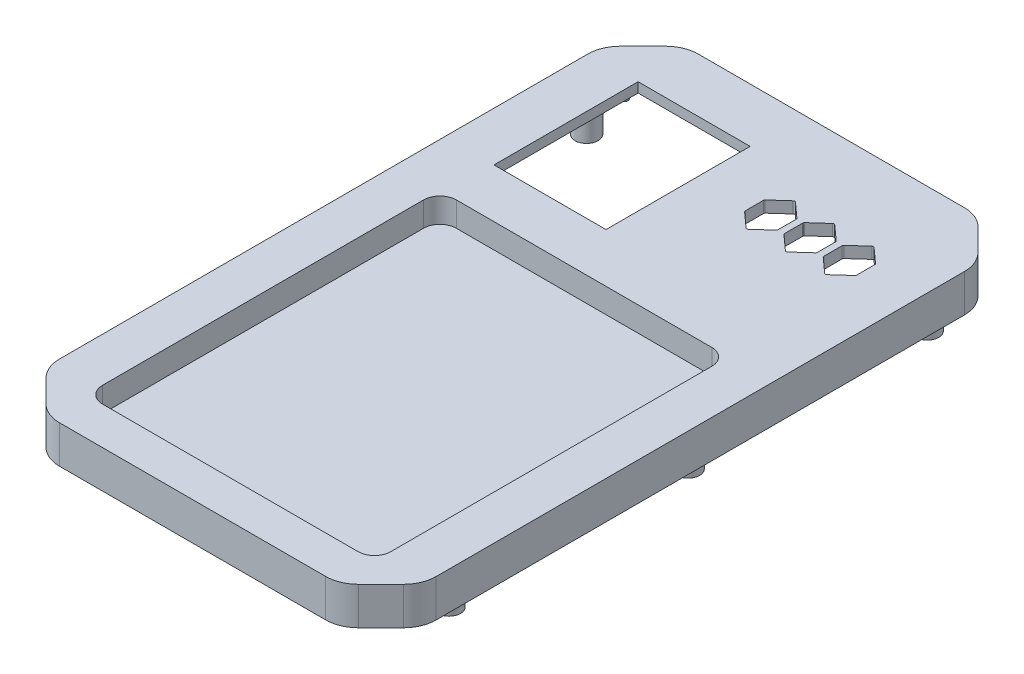
from build123d import *

# Parameters (mm, degrees)
BOSS_EXTRUDE4_DEPTH             = 20
FILLET4_R                       = 10
SKETCH5_W                       = 34.2
SKETCH5_H                       = 44
CUT_EXTRUDE4_DEPTH              = 7.5
SKETCH28_W                      = 49
SKETCH28_H                      = 35
CUT_EXTRUDE17_DEPTH             = 13
SHELL2_START                    = 1.5
SHELL2_OUTLINE_W                = 52
SHELL2_OUTLINE_H                = 38
SHELL2_DEPTH                    = 9.5
SHELL2_START_2                  = 11
SHELL2_2_OUTLINE_W              = 37.2
SHELL2_2_OUTLINE_H              = 47
SHELL2_2_OUTLINE_W_2            = 52
SHELL2_2_OUTLINE_H_2            = 38
SHELL2_2_DEPTH                  = 7.5
SHELL2_START_3                  = 14.5
SHELL2_3_OUTLINE_W              = 52
SHELL2_3_OUTLINE_H              = 38
SHELL2_3_DEPTH                  = 4
CUT_EXTRUDE15_REACH             = 218.444
FILLET3_R                       = 0.5
CUT_EXTRUDE18_REACH             = 217.88
SKETCH29_W                      = 34.2
SKETCH29_H                      = 44
BOSS_EXTRUDE11_DEPTH            = 9
SKETCH33_W                      = 1.5
SKETCH33_H                      = 4.6
CUT_EXTRUDE19_DEPTH             = 3
SKETCH34_W                      = 51
SKETCH34_H                      = 37
CUT_EXTRUDE22_DEPTH             = 3
SKETCH37_W                      = 25
SKETCH37_H                      = 11
BOSS_EXTRUDE13_DEPTH            = 7
CUT_EXTRUDE25_DEPTH             = 3
SKETCH38_R                      = 1.5
CUT_EXTRUDE26_DEPTH             = 5
SKETCH39_W                      = 7
SKETCH39_H                      = 2
CUT_EXTRUDE27_DEPTH             = 5
CUT_EXTRUDE28_START             = -10
CUT_EXTRUDE28_DEPTH             = 10
BOSS_EXTRUDE14_DEPTH            = 1.5
SKETCH46_R                      = 3.5
BOSS_EXTRUDE16_DEPTH            = 14
SKETCH52_R                      = 0.6
CUT_EXTRUDE30_DEPTH             = 12
CUT_EXTRUDE31_REACH             = 198.273
CUT_EXTRUDE31_DIRECTION_2_REACH = 198.273
SKETCH54_W                      = 37.2
SKETCH54_H                      = 47
CUT_EXTRUDE33_DEPTH             = 6
BOSS_EXTRUDE17_REACH            = 217.88
SKETCH57_W                      = 45
SKETCH57_H                      = 54
SKETCH57_W_2                    = 37.2
SKETCH57_H_2                    = 47
SKETCH58_R                      = 1.2
BOSS_EXTRUDE18_DEPTH            = 2
CUT_EXTRUDE34_DEPTH             = 0.5
BOSS_EXTRUDE19_DEPTH            = 2


# Read off the part's stored shape, not the designer's step: Shell2
with BuildPart() as part:
    # Sketch1 → Boss-Extrude4 (new body)
    with BuildSketch(Plane(origin=(0, 0, 0), x_dir=(1, 0, 0), z_dir=(0, 1, 0))):
        Polygon((12.727922061, 12.727922061), (102.272077939, 12.727922061), (115, 0), (115, -169.544155877), (102.272077939, -182.272077939), (12.727922061, -182.272077939), (0, -169.544155877), (0, 0), align=None)
    extrude(amount=BOSS_EXTRUDE4_DEPTH)

    # Fillet4
    fillet4_edges = [part.edges().sort_by_distance(p)[0] for p in [
        (115, 10, 0),
        (115, 10, 169.544155877),
        (102.272077939, 10, 182.272077939),
        (12.727922061, 10, 182.272077939),
        (0, 10, 169.544155877),
        (0, 10, 0),
        (12.727922061, 10, -12.727922061),
        (102.272077939, 10, -12.727922061),
    ]]
    fillet(fillet4_edges, radius=FILLET4_R)

    # Sketch5 → Cut-Extrude4 (cut)
    with BuildSketch(Plane(origin=(0, 20, 0), x_dir=(1, 0, 0), z_dir=(0, 1, 0))):
        with Locations((32.1, -25.772077939)):
            Rectangle(SKETCH5_W, SKETCH5_H)
        with BuildLine():
            Line((96.5, -62.772077939), (18.5, -62.772077939))
            ThreePointArc((18.5, -62.772077939), (14.964466094, -64.236544033), (13.5, -67.772077939))
            Line((13.5, -67.772077939), (13.5, -165.772077939))
            ThreePointArc((13.5, -165.772077939), (14.964466094, -169.307611845), (18.5, -170.772077939))
            Line((18.5, -170.772077939), (96.5, -170.772077939))
            ThreePointArc((96.5, -170.772077939), (100.035533906, -169.307611845), (101.5, -165.772077939))
            Line((101.5, -165.772077939), (101.5, -67.772077939))
            ThreePointArc((101.5, -67.772077939), (100.035533906, -64.236544033), (96.5, -62.772077939))
        make_face()
    extrude(amount=-CUT_EXTRUDE4_DEPTH, mode=Mode.SUBTRACT)

    # Sketch28 → Cut-Extrude17 (cut)
    with BuildSketch(Plane.XZ):
        with Locations((80.5, 39.772077939)):
            Rectangle(SKETCH28_W, SKETCH28_H)
    extrude(amount=-CUT_EXTRUDE17_DEPTH, mode=Mode.SUBTRACT)

    # Shell2 outline → Shell2 (cut)
    with BuildSketch(Plane(origin=(0, 0, 0), x_dir=(1, 0, 0), z_dir=(0, 1, 0)).offset(SHELL2_START)):
        with BuildLine():
            Line((111.01040764, 1.868272016), (104.140349955, 8.738329701))
            ThreePointArc((104.140349955, 8.738329701), (101.38275149, 10.580898088), (98.129942315, 11.227922061))
            Line((98.129942315, 11.227922061), (16.870057685, 11.227922061))
            ThreePointArc((16.870057685, 11.227922061), (13.61724851, 10.580898088), (10.859650045, 8.738329701))
            Line((10.859650045, 8.738329701), (3.98959236, 1.868272016))
            ThreePointArc((3.98959236, 1.868272016), (2.147023974, -0.889326449), (1.5, -4.142135624))
            Line((1.5, -4.142135624), (1.5, -165.402020254))
            ThreePointArc((1.5, -165.402020254), (2.147023974, -168.654829429), (3.98959236, -171.412427894))
            Line((3.98959236, -171.412427894), (10.859650045, -178.282485579))
            ThreePointArc((10.859650045, -178.282485579), (13.61724851, -180.125053965), (16.870057685, -180.772077939))
            Line((16.870057685, -180.772077939), (98.129942315, -180.772077939))
            ThreePointArc((98.129942315, -180.772077939), (101.38275149, -180.125053965), (104.140349955, -178.282485579))
            Line((104.140349955, -178.282485579), (111.01040764, -171.412427894))
            ThreePointArc((111.01040764, -171.412427894), (112.852976026, -168.654829429), (113.5, -165.402020254))
            Line((113.5, -165.402020254), (113.5, -4.142135624))
            ThreePointArc((113.5, -4.142135624), (112.852976026, -0.889326449), (111.01040764, 1.868272016))
        make_face()
        with Locations((80.5, -39.772077939)):
            Rectangle(SHELL2_OUTLINE_W, SHELL2_OUTLINE_H, mode=Mode.SUBTRACT)
    extrude(amount=SHELL2_DEPTH, mode=Mode.SUBTRACT)

    # Shell2 2 outline → Shell2 2 (cut)
    with BuildSketch(Plane(origin=(0, 0, 0), x_dir=(1, 0, 0), z_dir=(0, 1, 0)).offset(SHELL2_START_2)):
        with BuildLine():
            Line((111.01040764, 1.868272016), (104.140349955, 8.738329701))
            ThreePointArc((104.140349955, 8.738329701), (101.38275149, 10.580898088), (98.129942315, 11.227922061))
            Line((98.129942315, 11.227922061), (16.870057685, 11.227922061))
            ThreePointArc((16.870057685, 11.227922061), (13.61724851, 10.580898088), (10.859650045, 8.738329701))
            Line((10.859650045, 8.738329701), (3.98959236, 1.868272016))
            ThreePointArc((3.98959236, 1.868272016), (2.147023974, -0.889326449), (1.5, -4.142135624))
            Line((1.5, -4.142135624), (1.5, -165.402020254))
            ThreePointArc((1.5, -165.402020254), (2.147023974, -168.654829429), (3.98959236, -171.412427894))
            Line((3.98959236, -171.412427894), (10.859650045, -178.282485579))
            ThreePointArc((10.859650045, -178.282485579), (13.61724851, -180.125053965), (16.870057685, -180.772077939))
            Line((16.870057685, -180.772077939), (98.129942315, -180.772077939))
            ThreePointArc((98.129942315, -180.772077939), (101.38275149, -180.125053965), (104.140349955, -178.282485579))
            Line((104.140349955, -178.282485579), (111.01040764, -171.412427894))
            ThreePointArc((111.01040764, -171.412427894), (112.852976026, -168.654829429), (113.5, -165.402020254))
            Line((113.5, -165.402020254), (113.5, -4.142135624))
            ThreePointArc((113.5, -4.142135624), (112.852976026, -0.889326449), (111.01040764, 1.868272016))
        make_face()
        with BuildLine():
            ThreePointArc((18.5, -172.272077939), (13.903805923, -170.368272017), (12, -165.772077939))
            Line((12, -165.772077939), (12, -67.772077939))
            ThreePointArc((12, -67.772077939), (13.903805922, -63.175883861), (18.5, -61.272077939))
            Line((18.5, -61.272077939), (96.5, -61.272077939))
            ThreePointArc((96.5, -61.272077939), (101.096194078, -63.175883861), (103, -67.772077939))
            Line((103, -67.772077939), (103, -165.772077939))
            ThreePointArc((103, -165.772077939), (101.096194077, -170.368272017), (96.5, -172.272077939))
            Line((96.5, -172.272077939), (18.5, -172.272077939))
        make_face(mode=Mode.SUBTRACT)
        with Locations((32.1, -25.772077939)):
            Rectangle(SHELL2_2_OUTLINE_W, SHELL2_2_OUTLINE_H, mode=Mode.SUBTRACT)
        with Locations((80.5, -39.772077939)):
            Rectangle(SHELL2_2_OUTLINE_W_2, SHELL2_2_OUTLINE_H_2, mode=Mode.SUBTRACT)
    extrude(amount=SHELL2_2_DEPTH, mode=Mode.SUBTRACT)

    # Shell2 3 outline → Shell2 3 (cut)
    with BuildSketch(Plane(origin=(0, 0, 0), x_dir=(1, 0, 0), z_dir=(0, 1, 0)).offset(SHELL2_START_3)):
        with Locations((80.5, -39.772077939)):
            Rectangle(SHELL2_3_OUTLINE_W, SHELL2_3_OUTLINE_H)
    extrude(amount=SHELL2_3_DEPTH, mode=Mode.SUBTRACT)

    # Sketch23 → Cut-Extrude15 (cut, up to next)
    with BuildSketch(Plane(origin=(0, 20, 0), x_dir=(1, 0, 0), z_dir=(0, 1, 0)), mode=Mode.PRIVATE) as cut_extrude15_sk1:
        Polygon((99.5, -21.772077939), (99.5, -15.772077939), (94.5, -11.272077939), (89.5, -15.772077939), (89.5, -21.772077939), (94.5, -26.272077939), align=None)
    cut_extrude15_tool1 = extrude(cut_extrude15_sk1.sketch, amount=-CUT_EXTRUDE15_REACH, mode=Mode.PRIVATE) & part.part
    # Sketch23 → Cut-Extrude15 (cut, up to next)
    with BuildSketch(Plane(origin=(0, 20, 0), x_dir=(1, 0, 0), z_dir=(0, 1, 0)), mode=Mode.PRIVATE) as cut_extrude15_sk2:
        Polygon((87.5, -21.772077939), (87.5, -15.772077939), (82.5, -11.272077939), (77.5, -15.772077939), (77.5, -21.772077939), (82.5, -26.272077939), align=None)
    cut_extrude15_tool2 = extrude(cut_extrude15_sk2.sketch, amount=-CUT_EXTRUDE15_REACH, mode=Mode.PRIVATE) & part.part
    # Sketch23 → Cut-Extrude15 (cut, up to next)
    with BuildSketch(Plane(origin=(0, 20, 0), x_dir=(1, 0, 0), z_dir=(0, 1, 0)), mode=Mode.PRIVATE) as cut_extrude15_sk3:
        Polygon((75.5, -21.772077939), (75.5, -15.772077939), (70.5, -11.272077939), (65.5, -15.772077939), (65.5, -21.772077939), (70.5, -26.272077939), align=None)
    cut_extrude15_tool3 = extrude(cut_extrude15_sk3.sketch, amount=-CUT_EXTRUDE15_REACH, mode=Mode.PRIVATE) & part.part
    add(cut_extrude15_tool1.solids().sort_by_distance((94.5, 20, 18.772078))[0], mode=Mode.SUBTRACT)
    add(cut_extrude15_tool2.solids().sort_by_distance((82.5, 20, 18.772078))[0], mode=Mode.SUBTRACT)
    add(cut_extrude15_tool3.solids().sort_by_distance((70.5, 20, 18.772078))[0], mode=Mode.SUBTRACT)

    # Fillet3
    fillet3_edges = [part.edges().sort_by_distance(p)[0] for p in [
        (99.5, 19.25, 21.772077939),
        (94.5, 19.25, 26.272077939),
        (89.5, 19.25, 21.772077939),
        (89.5, 19.25, 15.772077939),
        (94.5, 19.25, 11.272077939),
        (99.5, 19.25, 15.772077939),
        (87.5, 19.25, 21.772077939),
        (82.5, 19.25, 26.272077939),
        (77.5, 19.25, 21.772077939),
        (77.5, 19.25, 15.772077939),
        (82.5, 19.25, 11.272077939),
        (87.5, 19.25, 15.772077939),
        (75.5, 19.25, 21.772077939),
        (70.5, 19.25, 26.272077939),
        (65.5, 19.25, 21.772077939),
        (65.5, 19.25, 15.772077939),
        (70.5, 19.25, 11.272077939),
        (75.5, 19.25, 15.772077939),
    ]]
    fillet(fillet3_edges, radius=FILLET3_R)

    # Sketch29 → Cut-Extrude18 (cut, up to next)
    with BuildSketch(Plane(origin=(0, 12.5, 0), x_dir=(1, 0, 0), z_dir=(0, 1, 0)), mode=Mode.PRIVATE) as cut_extrude18_sk1:
        with Locations((32.1, -25.772077939)):
            Rectangle(SKETCH29_W, SKETCH29_H)
    cut_extrude18_tool1 = extrude(cut_extrude18_sk1.sketch, amount=-CUT_EXTRUDE18_REACH, mode=Mode.PRIVATE) & part.part
    add(cut_extrude18_tool1.solids().sort_by_distance((32.1, 12.5, 25.772078))[0], mode=Mode.SUBTRACT)

    # Sketch30 → Boss-Extrude11 (add)
    with BuildSketch(Plane.XZ.offset(-13)):
        Polygon((58, 32.972077939), (58, 30.672077939), (57, 30.672077939), (57, 37.172077939), (58, 37.172077939), (58, 34.422077939), (103, 34.422077939), (103, 37.172077939), (104, 37.172077939), (104, 30.672077939), (103, 30.672077939), (103, 32.972077939), align=None)
        Polygon((58, 45.122077939), (103, 45.122077939), (103, 42.822077939), (104, 42.822077939), (104, 49.322077939), (103, 49.322077939), (103, 46.572077939), (58, 46.572077939), (58, 49.322077939), (57, 49.322077939), (57, 42.822077939), (58, 42.822077939), align=None)
    extrude(amount=BOSS_EXTRUDE11_DEPTH)

    # Sketch33 → Cut-Extrude19 (cut)
    with BuildSketch(Plane(origin=(0, 14.5, 0), x_dir=(1, 0, 0), z_dir=(0, 1, 0))):
        with Locations((55.25, -52.472077939)):
            Rectangle(SKETCH33_W, SKETCH33_H)
        with Locations((105.75, -27.072077939)):
            Rectangle(SKETCH33_W, SKETCH33_H)
    extrude(amount=-CUT_EXTRUDE19_DEPTH, mode=Mode.SUBTRACT)

    # Sketch34 → Cut-Extrude22 (cut)
    with BuildSketch(Plane.XZ):
        with Locations((80.5, 39.772077939)):
            Rectangle(SKETCH34_W, SKETCH34_H)
    extrude(amount=-CUT_EXTRUDE22_DEPTH, mode=Mode.SUBTRACT)

    # Sketch37 → Boss-Extrude13 (add)
    with BuildSketch(Plane(origin=(0, 1.5, 0), x_dir=(1, 0, 0), z_dir=(0, 1, 0))):
        with Locations((80.5, -15.272077939)):
            Rectangle(SKETCH37_W, SKETCH37_H)
    extrude(amount=BOSS_EXTRUDE13_DEPTH)

    # Sketch35 → Cut-Extrude25 (cut)
    with BuildSketch(Plane.XZ):
        with BuildLine():
            Line((88.5, 21.272077939), (72.5, 21.272077939))
            ThreePointArc((72.5, 21.272077939), (80.5, 13.272077939), (88.5, 21.272077939))
        make_face()
    extrude(amount=-CUT_EXTRUDE25_DEPTH, mode=Mode.SUBTRACT)

    # Sketch38 → Cut-Extrude26 (cut)
    with BuildSketch(Plane.XZ.offset(-3)):
        with Locations(Location((80.5, 18.272077939, 0), (0, 0, 270))):
            Circle(SKETCH38_R)
    extrude(amount=-CUT_EXTRUDE26_DEPTH, mode=Mode.SUBTRACT)

    # Sketch39 → Cut-Extrude27 (cut)
    with BuildSketch(Plane(origin=(0, 0, 58.272077939), x_dir=(-1, 0, 0), z_dir=(0, 0, -1))):
        with Locations((-94.5, 2)):
            Rectangle(SKETCH39_W, SKETCH39_H)
        with Locations((-66.5, 2)):
            Rectangle(SKETCH39_W, SKETCH39_H)
    extrude(amount=-CUT_EXTRUDE27_DEPTH, mode=Mode.SUBTRACT)

    # Sketch40 → Cut-Extrude28 (cut)
    with BuildSketch(Plane.XZ.offset(CUT_EXTRUDE28_START)):
        with BuildLine():
            Line((105.201010127, -9.798989873), (112.071067812, -2.928932188))
            ThreePointArc((112.071067812, -2.928932188), (114.238795325, 0.3153013), (115, 4.142135624))
            Line((115, 4.142135624), (115, 165.402020254))
            ThreePointArc((115, 165.402020254), (114.238795325, 169.228854577), (112.071067812, 172.473088065))
            Line((112.071067812, 172.473088065), (105.201010127, 179.343145751))
            ThreePointArc((105.201010127, 179.343145751), (101.956776639, 181.510873264), (98.129942315, 182.272077939))
            Line((98.129942315, 182.272077939), (16.870057685, 182.272077939))
            ThreePointArc((16.870057685, 182.272077939), (13.043223361, 181.510873264), (9.798989873, 179.343145751))
            Line((9.798989873, 179.343145751), (2.928932188, 172.473088065))
            ThreePointArc((2.928932188, 172.473088065), (0.761204675, 169.228854577), (0, 165.402020254))
            Line((0, 165.402020254), (0, 4.142135624))
            ThreePointArc((0, 4.142135624), (0.761204675, 0.3153013), (2.928932188, -2.928932188))
            Line((2.928932188, -2.928932188), (9.798989873, -9.798989873))
            ThreePointArc((9.798989873, -9.798989873), (13.043223361, -11.966717386), (16.870057685, -12.727922061))
            Line((16.870057685, -12.727922061), (98.129942315, -12.727922061))
            ThreePointArc((98.129942315, -12.727922061), (101.956776639, -11.966717386), (105.201010127, -9.798989873))
        make_face()
        with BuildLine():
            Line((98.129942315, 177.272077939), (16.870057685, 177.272077939))
            ThreePointArc((16.870057685, 177.272077939), (14.956640523, 176.891475601), (13.334523779, 175.807611845))
            Line((13.334523779, 175.807611845), (6.464466094, 168.937554159))
            ThreePointArc((6.464466094, 168.937554159), (5.380602337, 167.315437415), (5, 165.402020254))
            Line((5, 165.402020254), (5, 4.142135624))
            ThreePointArc((5, 4.142135624), (5.380602337, 2.228718462), (6.464466094, 0.606601718))
            Line((6.464466094, 0.606601718), (13.334523779, -6.263455967))
            ThreePointArc((13.334523779, -6.263455967), (14.956640523, -7.347319724), (16.870057685, -7.727922061))
            Line((16.870057685, -7.727922061), (98.129942315, -7.727922061))
            ThreePointArc((98.129942315, -7.727922061), (100.043359477, -7.347319724), (101.665476221, -6.263455967))
            Line((101.665476221, -6.263455967), (108.535533906, 0.606601718))
            ThreePointArc((108.535533906, 0.606601718), (109.619397663, 2.228718462), (110, 4.142135624))
            Line((110, 4.142135624), (110, 165.402020254))
            ThreePointArc((110, 165.402020254), (109.619397663, 167.315437415), (108.535533906, 168.937554159))
            Line((108.535533906, 168.937554159), (101.665476221, 175.807611845))
            ThreePointArc((101.665476221, 175.807611845), (100.043359477, 176.891475601), (98.129942315, 177.272077939))
        make_face(mode=Mode.SUBTRACT)
    extrude(amount=CUT_EXTRUDE28_DEPTH, mode=Mode.SUBTRACT)


with BuildPart() as cut_extrude28_piece_1:
    # of the separate pieces the step leaves, piece 1, a body of its own (cut_extrude28_pieces)
    add(part.part.solids().sort_by_distance((94.834482366, 20, 25.971043809))[0])

    # Sketch42 → Boss-Extrude14 (add)
    with BuildSketch(Plane.XZ.offset(-10)):
        with BuildLine():
            Line((16.870057685, -12.727922061), (98.129942315, -12.727922061))
            ThreePointArc((98.129942315, -12.727922061), (101.956776639, -11.966717386), (105.201010127, -9.798989873))
            Line((105.201010127, -9.798989873), (112.071067812, -2.928932188))
            ThreePointArc((112.071067812, -2.928932188), (114.238795325, 0.3153013), (115, 4.142135624))
            Line((115, 4.142135624), (115, 165.402020254))
            ThreePointArc((115, 165.402020254), (114.238795325, 169.228854577), (112.071067812, 172.473088065))
            Line((112.071067812, 172.473088065), (105.201010127, 179.343145751))
            ThreePointArc((105.201010127, 179.343145751), (101.956776639, 181.510873264), (98.129942315, 182.272077939))
            Line((98.129942315, 182.272077939), (16.870057685, 182.272077939))
            ThreePointArc((16.870057685, 182.272077939), (13.043223361, 181.510873264), (9.798989873, 179.343145751))
            Line((9.798989873, 179.343145751), (2.928932188, 172.473088065))
            ThreePointArc((2.928932188, 172.473088065), (0.761204675, 169.228854577), (0, 165.402020254))
            Line((0, 165.402020254), (0, 4.142135624))
            ThreePointArc((0, 4.142135624), (0.761204675, 0.3153013), (2.928932188, -2.928932188))
            Line((2.928932188, -2.928932188), (9.798989873, -9.798989873))
            ThreePointArc((9.798989873, -9.798989873), (13.043223361, -11.966717386), (16.870057685, -12.727922061))
        make_face()
        with BuildLine():
            Line((10.223253942, 178.918881682), (3.353196257, 172.048823997))
            ThreePointArc((3.353196257, 172.048823997), (1.315532394, 168.999244518), (0.6, 165.402020254))
            Line((0.6, 165.402020254), (0.6, 4.142135624))
            ThreePointArc((0.6, 4.142135624), (1.315532394, 0.544911359), (3.353196257, -2.504668119))
            Line((3.353196257, -2.504668119), (10.223253942, -9.374725805))
            ThreePointArc((10.223253942, -9.374725805), (13.272833421, -11.412389667), (16.870057685, -12.127922061))
            Line((16.870057685, -12.127922061), (98.129942315, -12.127922061))
            ThreePointArc((98.129942315, -12.127922061), (101.727166579, -11.412389667), (104.776746058, -9.374725805))
            Line((104.776746058, -9.374725805), (111.646803743, -2.504668119))
            ThreePointArc((111.646803743, -2.504668119), (113.684467606, 0.544911359), (114.4, 4.142135624))
            Line((114.4, 4.142135624), (114.4, 165.402020254))
            ThreePointArc((114.4, 165.402020254), (113.684467606, 168.999244518), (111.646803743, 172.048823997))
            Line((111.646803743, 172.048823997), (104.776746058, 178.918881682))
            ThreePointArc((104.776746058, 178.918881682), (101.727166579, 180.956545544), (98.129942315, 181.672077939))
            Line((98.129942315, 181.672077939), (16.870057685, 181.672077939))
            ThreePointArc((16.870057685, 181.672077939), (13.272833421, 180.956545544), (10.223253942, 178.918881682))
        make_face(mode=Mode.SUBTRACT)
    extrude(amount=BOSS_EXTRUDE14_DEPTH)

    # Sketch46 → Boss-Extrude16 (add)
    with BuildSketch(Plane.XZ.offset(-18.5)):
        with Locations(Location((5.5, 83, 0), (0, 0, 270))):
            Circle(SKETCH46_R)
        with Locations(Location((5.5, 10, 0), (0, 0, 270))):
            Circle(SKETCH46_R)
        with Locations(Location((109.5, 10, 0), (0, 0, 270))):
            Circle(SKETCH46_R)
        with Locations(Location((109.5, 83, 0), (0, 0, 270))):
            Circle(SKETCH46_R)
        with Locations(Location((109.5, 156, 0), (0, 0, 270))):
            Circle(SKETCH46_R)
        with Locations(Location((5.5, 156, 0), (0, 0, 270))):
            Circle(SKETCH46_R)
    extrude(amount=BOSS_EXTRUDE16_DEPTH)

    # Sketch52 → Cut-Extrude30 (cut)
    with BuildSketch(Plane.XZ.offset(-4.5)):
        with Locations(Location((5.5, 10, 0), (0, 0, 270))):
            Circle(SKETCH52_R)
        with Locations(Location((109.5, 10, 0), (0, 0, 270))):
            Circle(SKETCH52_R)
        with Locations(Location((5.5, 156, 0), (0, 0, 270))):
            Circle(SKETCH52_R)
        with Locations(Location((109.5, 156, 0), (0, 0, 270))):
            Circle(SKETCH52_R)
        with Locations(Location((109.5, 83, 0), (0, 0, 270))):
            Circle(SKETCH52_R)
        with Locations(Location((5.5, 83, 0), (0, 0, 270))):
            Circle(SKETCH52_R)
    extrude(amount=-CUT_EXTRUDE30_DEPTH, mode=Mode.SUBTRACT)

    # Sketch53 → Cut-Extrude31 (cut, up to next)
    with BuildSketch(Plane(origin=(70, 0, 0), x_dir=(0, 0, -1), z_dir=(1, 0, 0)), mode=Mode.PRIVATE) as cut_extrude31_sk1:
        Polygon((-61.272077939, 11), (-61.272077939, 12.079036209), (-62.560290397, 11), align=None)
    cut_extrude31_tool1 = extrude(cut_extrude31_sk1.sketch, amount=-CUT_EXTRUDE31_REACH, mode=Mode.PRIVATE) & cut_extrude28_piece_1.part
    add(cut_extrude31_tool1.solids().sort_by_distance((70, 11.359679, 61.701482))[0], mode=Mode.SUBTRACT)

    # Sketch53 → Cut-Extrude31 direction 2 (cut, up to next)
    with BuildSketch(Plane(origin=(70, 0, 0), x_dir=(0, 0, -1), z_dir=(1, 0, 0)), mode=Mode.PRIVATE) as cut_extrude31_direction_2_sk1:
        Polygon((-61.272077939, 11), (-61.272077939, 12.079036209), (-62.560290397, 11), align=None)
    cut_extrude31_direction_2_tool1 = extrude(cut_extrude31_direction_2_sk1.sketch, amount=CUT_EXTRUDE31_DIRECTION_2_REACH, mode=Mode.PRIVATE) & cut_extrude28_piece_1.part
    add(cut_extrude31_direction_2_tool1.solids().sort_by_distance((70, 11.359679, 61.701482))[0], mode=Mode.SUBTRACT)

    # Sketch54 → Cut-Extrude33 (cut)
    with BuildSketch(Plane.XZ.offset(-11)):
        with Locations((32.1, 25.772077939)):
            Rectangle(SKETCH54_W, SKETCH54_H)
    extrude(amount=-CUT_EXTRUDE33_DEPTH, mode=Mode.SUBTRACT)

    # Sketch57 → Boss-Extrude17 (add, up to next)
    with BuildSketch(Plane.XZ.offset(-17), mode=Mode.PRIVATE) as boss_extrude17_sk1:
        with Locations((32.1, 25.772077939)):
            Rectangle(SKETCH57_W, SKETCH57_H)
        with Locations((32.1, 25.772077939)):
            Rectangle(SKETCH57_W_2, SKETCH57_H_2, mode=Mode.SUBTRACT)
    boss_extrude17_tool1 = extrude(boss_extrude17_sk1.sketch, amount=-BOSS_EXTRUDE17_REACH, mode=Mode.PRIVATE) - cut_extrude28_piece_1.part
    add(boss_extrude17_tool1.solids().sort_by_distance((32.1, 17, -0.525))[0])

    # Sketch58 → Boss-Extrude18 (add)
    with BuildSketch(Plane.XZ.offset(-17)):
        with Locations(Location((12.3, 5.332077939, 0), (0, 0, 270))):
            Circle(SKETCH58_R)
        with Locations(Location((52.4, 5.332077939, 0), (0, 0, 270))):
            Circle(SKETCH58_R)
        with Locations(Location((52.4, 50.332077939, 0), (0, 0, 270))):
            Circle(SKETCH58_R)
        with Locations(Location((12.3, 50.332077939, 0), (0, 0, 270))):
            Circle(SKETCH58_R)
    extrude(amount=BOSS_EXTRUDE18_DEPTH)

    # Sketch59 → Cut-Extrude34 (cut)
    with BuildSketch(Plane.XZ.offset(-11)):
        with BuildLine():
            Line((12, 59.272077939), (103, 59.272077939))
            Line((103, 59.272077939), (103, 165.772077939))
            ThreePointArc((103, 165.772077939), (101.096194078, 170.368272016), (96.5, 172.272077939))
            Line((96.5, 172.272077939), (18.5, 172.272077939))
            ThreePointArc((18.5, 172.272077939), (13.903805922, 170.368272016), (12, 165.772077939))
            Line((12, 165.772077939), (12, 59.272077939))
        make_face()
    extrude(amount=-CUT_EXTRUDE34_DEPTH, mode=Mode.SUBTRACT)

    # Sketch60 → Boss-Extrude19 (add)
    with BuildSketch(Plane.XZ.offset(-18.5)):
        with BuildLine():
            Line((69.362759956, 26.862996785), (64.862759956, 22.812996785))
            ThreePointArc((64.862759956, 22.812996785), (64.447049892, 22.241022331), (64.3, 21.549396736))
            Line((64.3, 21.549396736), (64.3, 15.994759141))
            ThreePointArc((64.3, 15.994759141), (64.447049892, 15.303133547), (64.862759956, 14.731159092))
            Line((64.862759956, 14.731159092), (69.362759956, 10.681159092))
            ThreePointArc((69.362759956, 10.681159092), (70.5, 10.244759141), (71.637240044, 10.681159092))
            Line((71.637240044, 10.681159092), (76.137240044, 14.731159092))
            ThreePointArc((76.137240044, 14.731159092), (76.338839054, 14.947138033), (76.5, 15.194759141))
            ThreePointArc((76.5, 15.194759141), (76.661160946, 14.947138033), (76.862759956, 14.731159092))
            Line((76.862759956, 14.731159092), (81.362759956, 10.681159092))
            ThreePointArc((81.362759956, 10.681159092), (82.5, 10.244759141), (83.637240044, 10.681159092))
            Line((83.637240044, 10.681159092), (88.137240044, 14.731159092))
            ThreePointArc((88.137240044, 14.731159092), (88.338839054, 14.947138033), (88.5, 15.194759141))
            ThreePointArc((88.5, 15.194759141), (88.661160946, 14.947138033), (88.862759956, 14.731159092))
            Line((88.862759956, 14.731159092), (93.362759956, 10.681159092))
            ThreePointArc((93.362759956, 10.681159092), (94.5, 10.244759141), (95.637240044, 10.681159092))
            Line((95.637240044, 10.681159092), (100.137240044, 14.731159092))
            ThreePointArc((100.137240044, 14.731159092), (100.552950108, 15.303133547), (100.7, 15.994759141))
            Line((100.7, 15.994759141), (100.7, 21.549396736))
            ThreePointArc((100.7, 21.549396736), (100.552950108, 22.241022331), (100.137240044, 22.812996785))
            Line((100.137240044, 22.812996785), (95.637240044, 26.862996785))
            ThreePointArc((95.637240044, 26.862996785), (94.5, 27.299396736), (93.362759956, 26.862996785))
            Line((93.362759956, 26.862996785), (88.862759956, 22.812996785))
            ThreePointArc((88.862759956, 22.812996785), (88.661160946, 22.597017845), (88.5, 22.349396736))
            ThreePointArc((88.5, 22.349396736), (88.338839054, 22.597017845), (88.137240044, 22.812996785))
            Line((88.137240044, 22.812996785), (83.637240044, 26.862996785))
            ThreePointArc((83.637240044, 26.862996785), (82.5, 27.299396736), (81.362759956, 26.862996785))
            Line((81.362759956, 26.862996785), (76.862759956, 22.812996785))
            ThreePointArc((76.862759956, 22.812996785), (76.661160946, 22.597017845), (76.5, 22.349396736))
            ThreePointArc((76.5, 22.349396736), (76.338839054, 22.597017845), (76.137240044, 22.812996785))
            Line((76.137240044, 22.812996785), (71.637240044, 26.862996785))
            ThreePointArc((71.637240044, 26.862996785), (70.5, 27.299396736), (69.362759956, 26.862996785))
        make_face()
        with BuildLine():
            Line((94.165517634, 25.971043809), (89.665517634, 21.921043809))
            ThreePointArc((89.665517634, 21.921043809), (89.543249968, 21.752816029), (89.5, 21.549396736))
            Line((89.5, 21.549396736), (89.5, 15.994759141))
            ThreePointArc((89.5, 15.994759141), (89.543249968, 15.791339849), (89.665517634, 15.623112068))
            Line((89.665517634, 15.623112068), (94.165517634, 11.573112068))
            ThreePointArc((94.165517634, 11.573112068), (94.5, 11.444759141), (94.834482366, 11.573112068))
            Line((94.834482366, 11.573112068), (99.334482366, 15.623112068))
            ThreePointArc((99.334482366, 15.623112068), (99.456750032, 15.791339849), (99.5, 15.994759141))
            Line((99.5, 15.994759141), (99.5, 21.549396736))
            ThreePointArc((99.5, 21.549396736), (99.456750032, 21.752816029), (99.334482366, 21.921043809))
            Line((99.334482366, 21.921043809), (94.834482366, 25.971043809))
            ThreePointArc((94.834482366, 25.971043809), (94.5, 26.099396736), (94.165517634, 25.971043809))
        make_face(mode=Mode.SUBTRACT)
        with BuildLine():
            Line((82.165517634, 25.971043809), (77.665517634, 21.921043809))
            ThreePointArc((77.665517634, 21.921043809), (77.543249968, 21.752816029), (77.5, 21.549396736))
            Line((77.5, 21.549396736), (77.5, 15.994759141))
            ThreePointArc((77.5, 15.994759141), (77.543249968, 15.791339849), (77.665517634, 15.623112068))
            Line((77.665517634, 15.623112068), (82.165517634, 11.573112068))
            ThreePointArc((82.165517634, 11.573112068), (82.5, 11.444759141), (82.834482366, 11.573112068))
            Line((82.834482366, 11.573112068), (87.334482366, 15.623112068))
            ThreePointArc((87.334482366, 15.623112068), (87.456750032, 15.791339849), (87.5, 15.994759141))
            Line((87.5, 15.994759141), (87.5, 21.549396736))
            ThreePointArc((87.5, 21.549396736), (87.456750032, 21.752816029), (87.334482366, 21.921043809))
            Line((87.334482366, 21.921043809), (82.834482366, 25.971043809))
            ThreePointArc((82.834482366, 25.971043809), (82.5, 26.099396736), (82.165517634, 25.971043809))
        make_face(mode=Mode.SUBTRACT)
        with BuildLine():
            Line((70.165517634, 25.971043809), (65.665517634, 21.921043809))
            ThreePointArc((65.665517634, 21.921043809), (65.543249968, 21.752816029), (65.5, 21.549396736))
            Line((65.5, 21.549396736), (65.5, 15.994759141))
            ThreePointArc((65.5, 15.994759141), (65.543249968, 15.791339849), (65.665517634, 15.623112068))
            Line((65.665517634, 15.623112068), (70.165517634, 11.573112068))
            ThreePointArc((70.165517634, 11.573112068), (70.5, 11.444759141), (70.834482366, 11.573112068))
            Line((70.834482366, 11.573112068), (75.334482366, 15.623112068))
            ThreePointArc((75.334482366, 15.623112068), (75.456750032, 15.791339849), (75.5, 15.994759141))
            Line((75.5, 15.994759141), (75.5, 21.549396736))
            ThreePointArc((75.5, 21.549396736), (75.456750032, 21.752816029), (75.334482366, 21.921043809))
            Line((75.334482366, 21.921043809), (70.834482366, 25.971043809))
            ThreePointArc((70.834482366, 25.971043809), (70.5, 26.099396736), (70.165517634, 25.971043809))
        make_face(mode=Mode.SUBTRACT)
    extrude(amount=BOSS_EXTRUDE19_DEPTH)


with BuildPart() as cut_extrude28_piece_2:
    # of the separate pieces the step leaves, piece 2, a body of its own (cut_extrude28_pieces)
    add(part.part.solids().sort_by_distance((13.334523779, 0, -6.263455967))[0])


solid = cut_extrude28_piece_1.part
